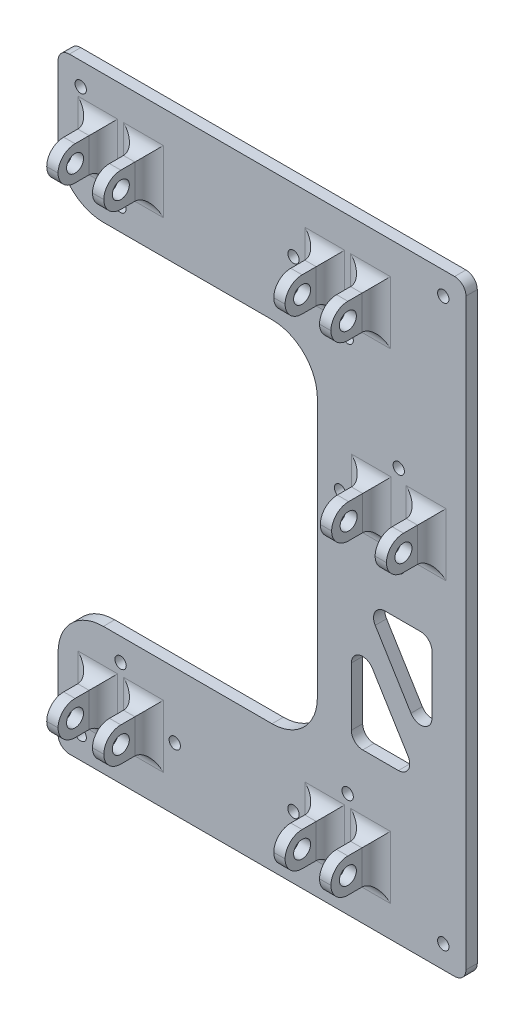
from build123d import *

# Parameters (mm, degrees)
SKETCH1_W           = 228.6
SKETCH1_H           = 339.725
BOSS_EXTRUDE1_DEPTH = 6.35
SKETCH2_W           = 6.35
SKETCH2_H           = 19.05
BOSS_EXTRUDE2_DEPTH = 25.4
FILLET1_R           = 9.525
FILLET2_R           = 8
SKETCH3_R           = 4.7625
CUT_EXTRUDE1_DEPTH  = 401.415210282
SKETCH5_R           = 3.175
CUT_EXTRUDE2_DEPTH  = 411.263568484
SKETCH9_W           = 145.328
SKETCH9_H           = 196.09
CUT_EXTRUDE3_DEPTH  = 411.263568484
FILLET3_R           = 25.4
FILLET4_R           = 6.35


with BuildPart() as part:
    # Sketch1 → Boss-Extrude1 (new body)
    with BuildSketch(Plane.XY):
        with Locations((114.3, -169.8625)):
            Rectangle(SKETCH1_W, SKETCH1_H)
    extrude(amount=BOSS_EXTRUDE1_DEPTH)

    # Sketch2 → Boss-Extrude2 (add)
    with BuildSketch(Plane.XY.offset(6.35)):
        with Locations((22.225, -35.56)):
            Rectangle(SKETCH2_W, SKETCH2_H)
        with Locations((47.879, -35.56)):
            Rectangle(SKETCH2_W, SKETCH2_H)
        with Locations((149.479, -35.56)):
            Rectangle(SKETCH2_W, SKETCH2_H)
        with Locations((175.133, -35.56)):
            Rectangle(SKETCH2_W, SKETCH2_H)
        with Locations((22.225, -304.8)):
            Rectangle(SKETCH2_W, SKETCH2_H)
        with Locations((47.879, -304.8)):
            Rectangle(SKETCH2_W, SKETCH2_H)
        with Locations((149.479, -304.8)):
            Rectangle(SKETCH2_W, SKETCH2_H)
        with Locations((175.133, -304.8)):
            Rectangle(SKETCH2_W, SKETCH2_H)
        with Locations((175.553, -132.588)):
            Rectangle(SKETCH2_W, SKETCH2_H)
        with Locations((206.287, -132.588)):
            Rectangle(SKETCH2_W, SKETCH2_H)
    extrude(amount=BOSS_EXTRUDE2_DEPTH)

    # Fillet1
    fillet1_edges = [part.edges().sort_by_distance(p)[0] for p in [
        (22.225, -314.325, 31.75),
        (22.225, -295.275, 31.75),
        (47.879, -314.325, 31.75),
        (47.879, -295.275, 31.75),
        (149.479, -314.325, 31.75),
        (149.479, -295.275, 31.75),
        (175.133, -314.325, 31.75),
        (175.133, -295.275, 31.75),
        (206.287, -142.113, 31.75),
        (206.287, -123.063, 31.75),
        (175.553, -142.113, 31.75),
        (175.553, -123.063, 31.75),
        (175.133, -45.085, 31.75),
        (175.133, -26.035, 31.75),
        (149.479, -45.085, 31.75),
        (149.479, -26.035, 31.75),
        (47.879, -45.085, 31.75),
        (47.879, -26.035, 31.75),
        (22.225, -45.085, 31.75),
        (22.225, -26.035, 31.75),
    ]]
    fillet(fillet1_edges, radius=FILLET1_R - 0.0001)  # a hair under: the kernel refuses the full size

    # Fillet2
    fillet2_edges = [part.edges().sort_by_distance(p)[0] for p in [
        (22.225, -295.275, 6.35),
        (19.05, -304.8, 6.35),
        (25.4, -304.8, 6.35),
        (22.225, -314.325, 6.35),
        (44.704, -304.8, 6.35),
        (47.879, -314.325, 6.35),
        (51.054, -304.8, 6.35),
        (47.879, -295.275, 6.35),
        (22.225, -26.035, 6.35),
        (19.05, -35.56, 6.35),
        (25.4, -35.56, 6.35),
        (22.225, -45.085, 6.35),
        (44.704, -35.56, 6.35),
        (47.879, -45.085, 6.35),
        (51.054, -35.56, 6.35),
        (47.879, -26.035, 6.35),
        (149.479, -26.035, 6.35),
        (146.304, -35.56, 6.35),
        (152.654, -35.56, 6.35),
        (149.479, -45.085, 6.35),
        (171.958, -35.56, 6.35),
        (175.133, -45.085, 6.35),
        (178.308, -35.56, 6.35),
        (175.133, -26.035, 6.35),
        (175.553, -123.063, 6.35),
        (172.378, -132.588, 6.35),
        (178.728, -132.588, 6.35),
        (175.553, -142.113, 6.35),
        (203.112, -132.588, 6.35),
        (206.287, -142.113, 6.35),
        (209.462, -132.588, 6.35),
        (206.287, -123.063, 6.35),
        (171.958, -304.8, 6.35),
        (175.133, -314.325, 6.35),
        (178.308, -304.8, 6.35),
        (175.133, -295.275, 6.35),
        (149.479, -295.275, 6.35),
        (146.304, -304.8, 6.35),
        (152.654, -304.8, 6.35),
        (149.479, -314.325, 6.35),
    ]]
    fillet(fillet2_edges, radius=FILLET2_R)

    # Sketch3 → Cut-Extrude1 (cut, through all)
    with BuildSketch(Plane.ZY.offset(-19.05)):
        with Locations(Location((22.225, -35.56, 0), (0, 0, 180))):
            Circle(SKETCH3_R)
        with Locations(Location((22.225, -132.588, 0), (0, 0, 180))):
            Circle(SKETCH3_R)
        with Locations(Location((22.225, -304.8, 0), (0, 0, 180))):
            Circle(SKETCH3_R)
    extrude(amount=-CUT_EXTRUDE1_DEPTH, mode=Mode.SUBTRACT)

    # Sketch5 → Cut-Extrude2 (cut, through all)
    with BuildSketch(Plane.XY.offset(6.35)):
        with Locations((12.7, -12.7)):
            Circle(SKETCH5_R)
        with Locations((34.925, -59.435)):
            Circle(SKETCH5_R)
        with Locations((131.954, -35.56)):
            Circle(SKETCH5_R)
        with Locations((215.9, -12.7)):
            Circle(SKETCH5_R)
        with Locations((162.306, -59.435)):
            Circle(SKETCH5_R)
        with Locations((190.92, -108.713)):
            Circle(SKETCH5_R)
        with Locations((158.028, -136.132936151)):
            Circle(SKETCH5_R)
        with Locations((190.92, -156.463)):
            Circle(SKETCH5_R)
        with Locations((215.9, -327.025)):
            Circle(SKETCH5_R)
        with Locations((162.306, -280.925)):
            Circle(SKETCH5_R)
        with Locations((131.954, -304.8)):
            Circle(SKETCH5_R)
        with Locations((65.404, -304.8)):
            Circle(SKETCH5_R)
        with Locations((35.052, -280.925)):
            Circle(SKETCH5_R)
        with Locations((12.7, -327.025)):
            Circle(SKETCH5_R)
    extrude(amount=-CUT_EXTRUDE2_DEPTH, mode=Mode.SUBTRACT)

    # Sketch9 → Cut-Extrude3 (cut, through all)
    with BuildSketch(Plane.XY.offset(6.35)):
        with Locations((72.664, -170.18)):
            Rectangle(SKETCH9_W, SKETCH9_H)
        Polygon((202.101108352, -255.525), (164.378, -194.009910842), (164.378, -255.525), align=None)
        Polygon((209.55, -181.863), (171.826891648, -181.863), (209.55, -243.378089158), align=None)
    extrude(amount=-CUT_EXTRUDE3_DEPTH, mode=Mode.SUBTRACT)

    # Fillet3
    fillet3_edges = [part.edges().sort_by_distance(p)[0] for p in [
        (145.328, -72.135, 3.175),
        (145.328, -268.225, 3.175),
        (0, -268.225, 3.175),
        (0, -72.135, 3.175),
    ]]
    fillet(fillet3_edges, radius=FILLET3_R)

    # Fillet4
    fillet4_edges = [part.edges().sort_by_distance(p)[0] for p in [
        (171.826891648, -181.863, 3.175),
        (209.55, -181.863, 3.175),
        (209.55, -243.378089158, 3.175),
        (164.378, -194.009910842, 3.175),
        (202.101108352, -255.525, 3.175),
        (164.378, -255.525, 3.175),
        (0, 0, 3.175),
        (228.6, 0, 3.175),
        (228.6, -339.725, 3.175),
        (0, -339.725, 3.175),
    ]]
    fillet(fillet4_edges, radius=FILLET4_R)


solid = part.part
